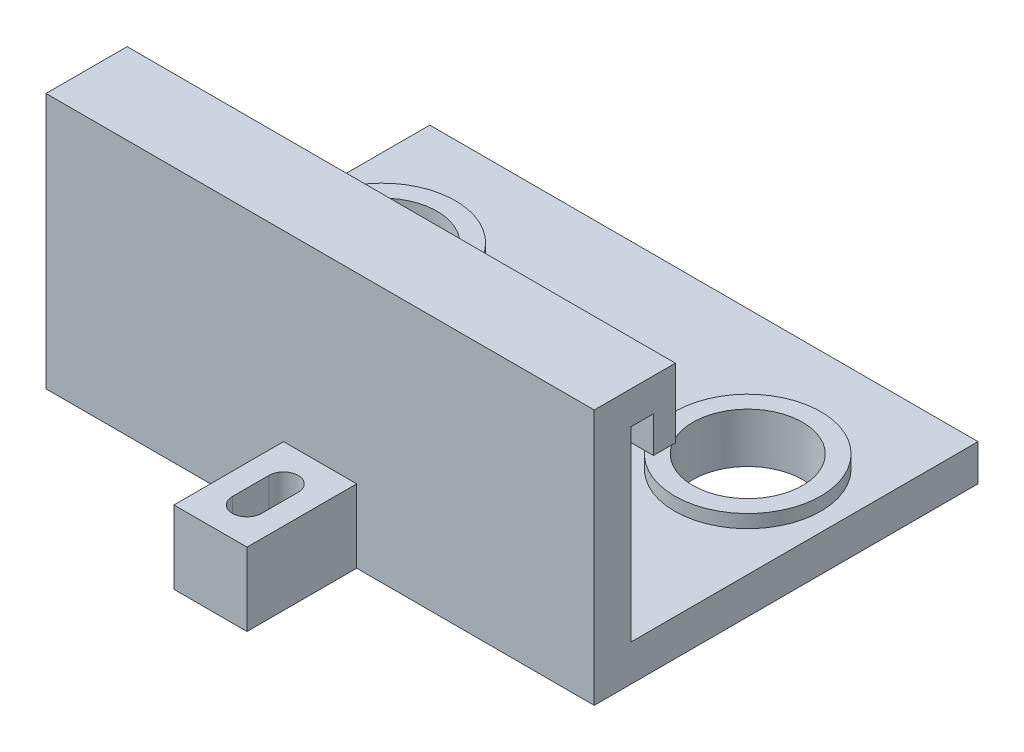
from build123d import *

# Parameters (mm, degrees)
SKETCH1_W           = 75
SKETCH1_H           = 52.5
BOSS_EXTRUDE1_DEPTH = 35
CUT_EXTRUDE2_DEPTH  = 75
SKETCH4_R           = 10
BOSS_EXTRUDE2_DEPTH = 4
SKETCH7_W           = 10
SKETCH7_H           = 15
BOSS_EXTRUDE4_DEPTH = 10
SKETCH8_3_R         = 7.5
CUT_EXTRUDE3_DEPTH  = 12.5
BOSS_EXTRUDE5_START = 2.8
SKETCH8_R           = 10
SKETCH8_R_2         = 7.5
BOSS_EXTRUDE5_DEPTH = 2.8


with BuildPart() as part:
    # Sketch1 → Boss-Extrude1 (new body)
    with BuildSketch(Plane(origin=(0, 0, 0), x_dir=(1, 0, 0), z_dir=(0, 1, 0))):
        Rectangle(SKETCH1_W, SKETCH1_H)
    extrude(amount=BOSS_EXTRUDE1_DEPTH)

    # Sketch3 → Cut-Extrude2 (cut)
    with BuildSketch(Plane(origin=(37.5, 0, 0), x_dir=(0, 0, -1), z_dir=(1, 0, 0))):
        Polygon((-21.25, 5), (26.25, 5), (26.25, 35), (-15.15, 35), (-15.15, 25.548596965), (-18.15, 25.548596965), (-18.15, 30.5), (-21.25, 30.5), align=None)
    extrude(amount=-CUT_EXTRUDE2_DEPTH, mode=Mode.SUBTRACT)

    # Sketch4 → Boss-Extrude2 (add)
    with BuildSketch(Plane.XZ):
        with Locations((-25, -2.75)):
            Circle(SKETCH4_R)
        with Locations((25, -2.75)):
            Circle(SKETCH4_R)
    extrude(amount=-BOSS_EXTRUDE2_DEPTH)

    # Sketch7 → Boss-Extrude4 (add)
    with BuildSketch(Plane.XZ):
        with Locations((0, 33.75)):
            Rectangle(SKETCH7_W, SKETCH7_H)
        with BuildLine():
            Line((2, 36.25), (2, 31.25))
            ThreePointArc((2, 31.25), (0, 29.25), (-2, 31.25))
            Line((-2, 31.25), (-2, 36.25))
            ThreePointArc((-2, 36.25), (0, 38.25), (2, 36.25))
        make_face(mode=Mode.SUBTRACT)
    extrude(amount=-BOSS_EXTRUDE4_DEPTH)

    # Sketch8<3> → Cut-Extrude3 (cut, symmetric)
    with BuildSketch(Plane(origin=(0, 4, 0), x_dir=(1, 0, 0), z_dir=(0, 1, 0))):
        with Locations((-25, 7.25)):
            Circle(SKETCH8_3_R)
        with Locations((25, 7.25)):
            Circle(SKETCH8_3_R)
    extrude(amount=CUT_EXTRUDE3_DEPTH, both=True, mode=Mode.SUBTRACT)

    # Sketch8 → Boss-Extrude5 (add)
    # profile 1 of 2: a face of its own
    with BuildSketch(Plane(origin=(0, 4, 0), x_dir=(1, 0, 0), z_dir=(0, 1, 0)).offset(BOSS_EXTRUDE5_START)):
        with Locations((-25, 7.25)):
            Circle(SKETCH8_R)
        with Locations((-25, 7.25)):
            Circle(SKETCH8_R_2, mode=Mode.SUBTRACT)
    # profile 2 of 2: a face of its own
    with BuildSketch(Plane(origin=(0, 4, 0), x_dir=(1, 0, 0), z_dir=(0, 1, 0)).offset(BOSS_EXTRUDE5_START)):
        with Locations((25, 7.25)):
            Circle(SKETCH8_R)
        with Locations((25, 7.25)):
            Circle(SKETCH8_R_2, mode=Mode.SUBTRACT)
    extrude(amount=-BOSS_EXTRUDE5_DEPTH)


solid = part.part
